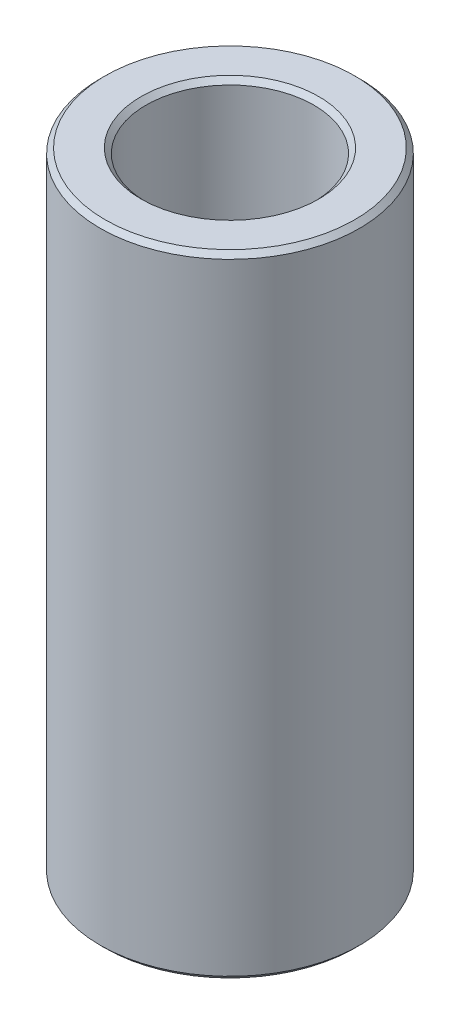
from build123d import *

# Parameters (mm, degrees)
SKETCH1_R           = 57.5
BOSS_EXTRUDE1_DEPTH = 279.66699872
SKETCH2_R           = 37.203642717
CUT_EXTRUDE1_DEPTH  = 292.249257807
CHAMFER1_SIZE       = 2.190954445


with BuildPart() as part:
    # Sketch1 → Boss-Extrude1 (new body)
    with BuildSketch(Plane(origin=(0, 0, 0), x_dir=(1, 0, 0), z_dir=(0, 1, 0))):
        Circle(SKETCH1_R)
    extrude(amount=BOSS_EXTRUDE1_DEPTH)

    # Sketch2 → Cut-Extrude1 (cut, through all)
    with BuildSketch(Plane(origin=(0, 0, 0), x_dir=(1, 0, 0), z_dir=(0, 1, 0))):
        Circle(SKETCH2_R)
    extrude(amount=CUT_EXTRUDE1_DEPTH, mode=Mode.SUBTRACT)

    # Chamfer1
    chamfer1_edges = [part.edges().sort_by_distance(p)[0] for p in [
        (-37.203642717, 279.66699872, 0),
        (-37.203642717, 0, 0),
        (-57.5, 0, 0),
        (-57.5, 279.66699872, 0),
    ]]
    chamfer(chamfer1_edges, length=CHAMFER1_SIZE)


solid = part.part
